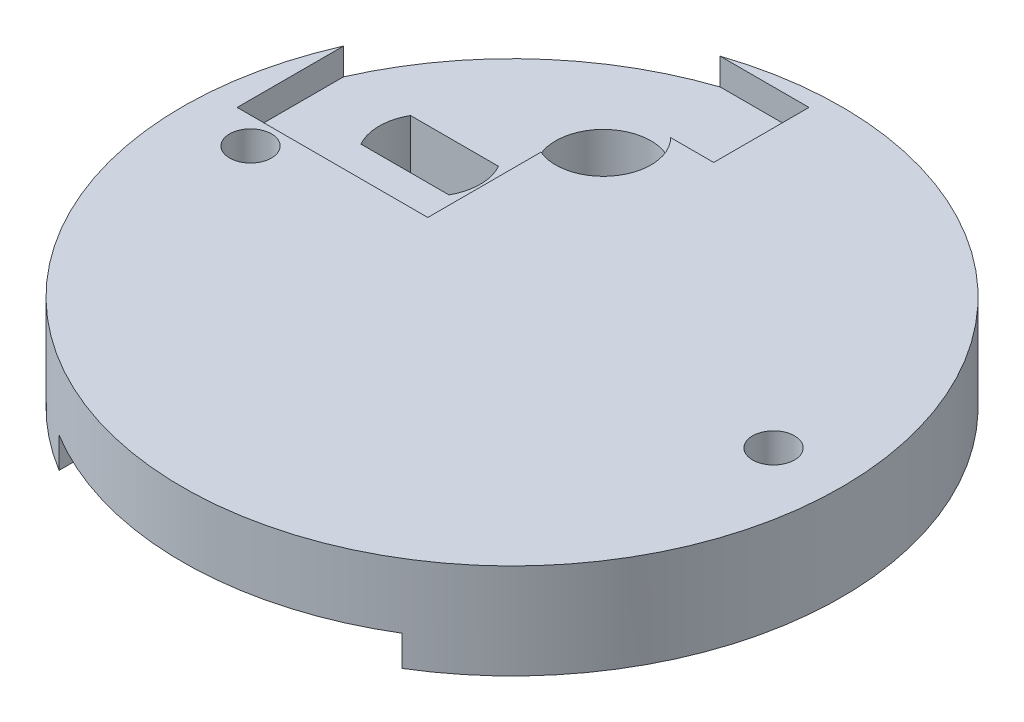
from build123d import *

# Parameters (mm, degrees)
SKETCH_1_R          = 17.29
SKETCH_1_R_2        = 1.1
SKETCH_1_R_3        = 2.5
EXTRUDE_1_DEPTH     = 4
SKETCH_2_W          = 4
SKETCH_2_H          = 4.8
SKETCH_2_H_2        = 3.4
SKETCH_2_W_2        = 4.4
SKETCH_2_H_3        = 4
SKETCH_2_W_3        = 18
SKETCH_2_H_4        = 12
CUT_EXTRUDE_1_DEPTH = 1.6
SKETCH_3_R          = 17.29
SKETCH_3_R_2        = 2.5
SKETCH_3_R_3        = 1.1
EXTRUDE_2_DEPTH     = 1
CUT_EXTRUDE_2_DEPTH = 1.4


with BuildPart() as part:
    # 草图1 → 凸台-拉伸1 (new body)
    with BuildSketch(Plane(origin=(0, 0, 0), x_dir=(1, 0, 0), z_dir=(0, 1, 0))):
        Circle(SKETCH_1_R)
        with Locations((-13.72, 0)):
            Circle(SKETCH_1_R_2, mode=Mode.SUBTRACT)
        with Locations((13.72, 0)):
            Circle(SKETCH_1_R_2, mode=Mode.SUBTRACT)
        with Locations((-4.85, 9.64)):
            Circle(SKETCH_1_R_3, mode=Mode.SUBTRACT)
        with BuildLine():
            Line((-12.309220648, 6.98), (-7.690779352, 6.98))
            ThreePointArc((-7.690779352, 6.98), (-7.35, 5.68), (-7.690779352, 4.38))
            Line((-7.690779352, 4.38), (-12.309220648, 4.38))
            ThreePointArc((-12.309220648, 4.38), (-12.65, 5.68), (-12.309220648, 6.98))
        make_face(mode=Mode.SUBTRACT)
        with BuildLine():
            Line((12.309220648, 6.98), (7.690779352, 6.98))
            ThreePointArc((7.690779352, 6.98), (7.35, 5.68), (7.690779352, 4.38))
            Line((7.690779352, 4.38), (12.309220648, 4.38))
            ThreePointArc((12.309220648, 4.38), (12.65, 5.68), (12.309220648, 6.98))
        make_face(mode=Mode.SUBTRACT)
    extrude(amount=EXTRUDE_1_DEPTH)

    # 草图2 → 切除-拉伸1 (cut)
    with BuildSketch(Plane.XZ):
        with Locations((-7.22, 0.9)):
            Rectangle(SKETCH_2_W, SKETCH_2_H)
        with Locations((8, -1.1)):
            Rectangle(SKETCH_2_W, SKETCH_2_H_2)
        with Locations((-14.996048965, 3.8)):
            Rectangle(SKETCH_2_W_2, SKETCH_2_H_3)
        with Locations((0, 11.29)):
            Rectangle(SKETCH_2_W_3, SKETCH_2_H_4)
    extrude(amount=-CUT_EXTRUDE_1_DEPTH, mode=Mode.SUBTRACT)

    # 草图3 → 凸台-拉伸2 (add)
    with BuildSketch(Plane(origin=(0, 4, 0), x_dir=(1, 0, 0), z_dir=(0, 1, 0))):
        Circle(SKETCH_3_R)
        with Locations((-4.85, 9.64)):
            Circle(SKETCH_3_R_2, mode=Mode.SUBTRACT)
        with Locations((-13.72, 0)):
            Circle(SKETCH_3_R_3, mode=Mode.SUBTRACT)
        with Locations((13.72, 0)):
            Circle(SKETCH_3_R_3, mode=Mode.SUBTRACT)
    extrude(amount=EXTRUDE_2_DEPTH)

    # 草图4 → 切除-拉伸2 (cut)
    with BuildSketch(Plane(origin=(0, 5, 0), x_dir=(1, 0, 0), z_dir=(0, 1, 0))):
        Polygon((-15.82, 16.4), (-5.82, 16.4), (-0.82, 16.4), (-0.82, 11.4), (-5.82, 11.4), (-5.82, 1.4), (-15.82, 1.4), align=None)
    extrude(amount=-CUT_EXTRUDE_2_DEPTH, mode=Mode.SUBTRACT)


solid = part.part
